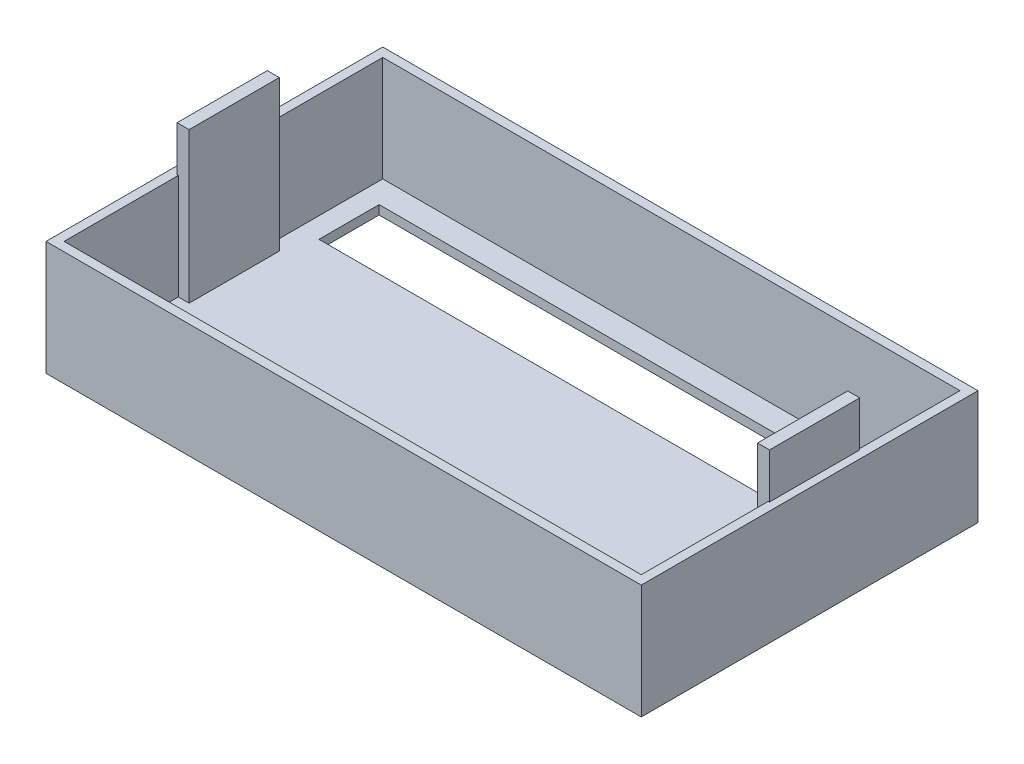
from build123d import *

# Parameters (mm, degrees)
SKETCH1_W           = 99
SKETCH1_H           = 56
BOSS_EXTRUDE1_DEPTH = 19
SHELL1_T            = -1.5
SKETCH10_W          = 2
SKETCH10_H          = 15
BOSS_EXTRUDE4_DEPTH = 25
SKETCH12_W          = 2
SKETCH12_H          = 15
BOSS_EXTRUDE5_DEPTH = 25
SKETCH14_W          = 89.2
SKETCH14_H          = 10
CUT_EXTRUDE3_DEPTH  = 10


with BuildPart() as part:
    # Sketch1 → Boss-Extrude1 (new body)
    with BuildSketch(Plane(origin=(0, 0, 0), x_dir=(1, 0, 0), z_dir=(0, 1, 0))):
        Rectangle(SKETCH1_W, SKETCH1_H)
    extrude(amount=BOSS_EXTRUDE1_DEPTH)

    # Shell1
    shell1_openings = [part.faces().sort_by_distance(p)[0] for p in [
        (0, 19, 0),
    ]]
    offset(amount=SHELL1_T, openings=shell1_openings, kind=Kind.INTERSECTION)

    # Sketch10 → Boss-Extrude4 (add)
    with BuildSketch(Plane(origin=(0, 1.5, 0), x_dir=(1, 0, 0), z_dir=(0, 1, 0))):
        with Locations((-47.2, 0)):
            Rectangle(SKETCH10_W, SKETCH10_H)
    extrude(amount=BOSS_EXTRUDE4_DEPTH)

    # Sketch12 → Boss-Extrude5 (add)
    with BuildSketch(Plane(origin=(0, 1.5, 0), x_dir=(1, 0, 0), z_dir=(0, 1, 0))):
        with Locations((47.2, 2.130725465)):
            Rectangle(SKETCH12_W, SKETCH12_H)
    extrude(amount=BOSS_EXTRUDE5_DEPTH)

    # Sketch14 → Cut-Extrude3 (cut)
    with BuildSketch(Plane(origin=(0, 1.5, 0), x_dir=(1, 0, 0), z_dir=(0, 1, 0))):
        with Locations((0, 17.5)):
            Rectangle(SKETCH14_W, SKETCH14_H)
    extrude(amount=-CUT_EXTRUDE3_DEPTH, mode=Mode.SUBTRACT)


solid = part.part
